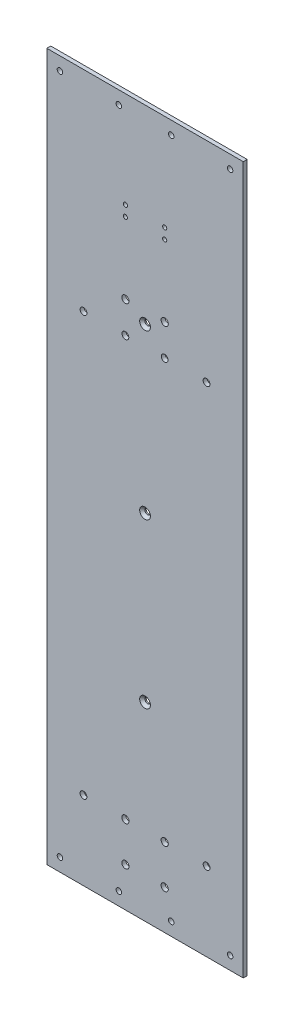
from build123d import *

# Parameters (mm, degrees)
SKETCH_1_W          = 150
SKETCH_1_H          = 540
EXTRUDE_1_DEPTH     = 3
SKETCH_2_R          = 2.1
SKETCH_2_R_2        = 1.6
CUT_EXTRUDE_1_DEPTH = 281.239183556
CUT_EXTRUDE_2_REACH = 282.239
SKETCH_4_R          = 2.1
CHAMFER_1_SIZE      = 2
CUT_EXTRUDE_4_REACH = 282.239
SKETCH_6_R          = 2.6
SKETCH_6_R_2        = 2.599999997
CUT_EXTRUDE_5_REACH = 282.239
SKETCH_7_R          = 2.75
CUT_EXTRUDE_6_REACH = 282.239
SKETCH_8_R          = 2.75
SKETCH_9_R          = 2.75
CUT_EXTRUDE_7_DEPTH = 10


with BuildPart() as part:
    # 草图1 → 凸台-拉伸1 (new body)
    with BuildSketch(Plane.XY):
        Rectangle(SKETCH_1_W, SKETCH_1_H)
    extrude(amount=EXTRUDE_1_DEPTH)

    # 草图2 → 切除-拉伸1 (cut, through all)
    with BuildSketch(Plane(origin=(0, 0, 0), x_dir=(-1, 0, 0), z_dir=(0, 0, -1))):
        with Locations((65, -260)):
            Circle(SKETCH_2_R)
        with Locations((-65, -260)):
            Circle(SKETCH_2_R)
        with Locations((65, 260)):
            Circle(SKETCH_2_R)
        with Locations((-65, 260)):
            Circle(SKETCH_2_R)
        with Locations((-20, -260)):
            Circle(SKETCH_2_R)
        with Locations((20, -260)):
            Circle(SKETCH_2_R)
        with Locations((20, 260)):
            Circle(SKETCH_2_R)
        with Locations((-20, 260)):
            Circle(SKETCH_2_R)
        with Locations((15, 196.5)):
            Circle(SKETCH_2_R_2)
        with Locations((15, 188.5)):
            Circle(SKETCH_2_R_2)
        with Locations((-15, 196.5)):
            Circle(SKETCH_2_R_2)
        with Locations((-15, 188.5)):
            Circle(SKETCH_2_R_2)
    extrude(amount=-CUT_EXTRUDE_1_DEPTH, mode=Mode.SUBTRACT)

    # 草图4 → 切除-拉伸2 (cut, up to next)
    with BuildSketch(Plane.XY.offset(3), mode=Mode.PRIVATE) as cut_extrude_2_sk1:
        with Locations((0, 125)):
            Circle(SKETCH_4_R)
    cut_extrude_2_tool1 = extrude(cut_extrude_2_sk1.sketch, amount=-CUT_EXTRUDE_2_REACH, mode=Mode.PRIVATE) & part.part
    # 草图4 → 切除-拉伸2 (cut, up to next)
    with BuildSketch(Plane.XY.offset(3), mode=Mode.PRIVATE) as cut_extrude_2_sk2:
        with Locations((0, -125)):
            Circle(SKETCH_4_R)
    cut_extrude_2_tool2 = extrude(cut_extrude_2_sk2.sketch, amount=-CUT_EXTRUDE_2_REACH, mode=Mode.PRIVATE) & part.part
    # 草图4 → 切除-拉伸2 (cut, up to next)
    with BuildSketch(Plane.XY.offset(3), mode=Mode.PRIVATE) as cut_extrude_2_sk3:
        Circle(SKETCH_4_R)
    cut_extrude_2_tool3 = extrude(cut_extrude_2_sk3.sketch, amount=-CUT_EXTRUDE_2_REACH, mode=Mode.PRIVATE) & part.part
    add(cut_extrude_2_tool1.solids().sort_by_distance((0, 125, 3))[0], mode=Mode.SUBTRACT)
    add(cut_extrude_2_tool2.solids().sort_by_distance((0, -125, 3))[0], mode=Mode.SUBTRACT)
    add(cut_extrude_2_tool3.solids().sort_by_distance((0, 0, 3))[0], mode=Mode.SUBTRACT)

    # 倒角1
    chamfer_1_edges = [part.edges().sort_by_distance(p)[0] for p in [
        (-2.1, 0, 3),
        (-2.1, -125, 3),
        (-2.1, 125, 3),
    ]]
    chamfer(chamfer_1_edges, length=CHAMFER_1_SIZE)

    # 草图6 → 切除-拉伸4 (cut, up to next)
    with BuildSketch(Plane.XY.offset(3), mode=Mode.PRIVATE) as cut_extrude_4_sk1:
        with Locations((15, -210)):
            Circle(SKETCH_6_R)
    cut_extrude_4_tool1 = extrude(cut_extrude_4_sk1.sketch, amount=-CUT_EXTRUDE_4_REACH, mode=Mode.PRIVATE) & part.part
    # 草图6 → 切除-拉伸4 (cut, up to next)
    with BuildSketch(Plane.XY.offset(3), mode=Mode.PRIVATE) as cut_extrude_4_sk2:
        with Locations((-15, -210)):
            Circle(SKETCH_6_R)
    cut_extrude_4_tool2 = extrude(cut_extrude_4_sk2.sketch, amount=-CUT_EXTRUDE_4_REACH, mode=Mode.PRIVATE) & part.part
    # 草图6 → 切除-拉伸4 (cut, up to next)
    with BuildSketch(Plane.XY.offset(3), mode=Mode.PRIVATE) as cut_extrude_4_sk3:
        with Locations((47, -210)):
            Circle(SKETCH_6_R)
    cut_extrude_4_tool3 = extrude(cut_extrude_4_sk3.sketch, amount=-CUT_EXTRUDE_4_REACH, mode=Mode.PRIVATE) & part.part
    # 草图6 → 切除-拉伸4 (cut, up to next)
    with BuildSketch(Plane.XY.offset(3), mode=Mode.PRIVATE) as cut_extrude_4_sk4:
        with Locations((-47, -210)):
            Circle(SKETCH_6_R)
    cut_extrude_4_tool4 = extrude(cut_extrude_4_sk4.sketch, amount=-CUT_EXTRUDE_4_REACH, mode=Mode.PRIVATE) & part.part
    # 草图6 → 切除-拉伸4 (cut, up to next)
    with BuildSketch(Plane.XY.offset(3), mode=Mode.PRIVATE) as cut_extrude_4_sk5:
        with Locations((-47, 110)):
            Circle(SKETCH_6_R)
    cut_extrude_4_tool5 = extrude(cut_extrude_4_sk5.sketch, amount=-CUT_EXTRUDE_4_REACH, mode=Mode.PRIVATE) & part.part
    # 草图6 → 切除-拉伸4 (cut, up to next)
    with BuildSketch(Plane.XY.offset(3), mode=Mode.PRIVATE) as cut_extrude_4_sk6:
        with Locations((-14.999999999, 110.000445606)):
            Circle(SKETCH_6_R)
    cut_extrude_4_tool6 = extrude(cut_extrude_4_sk6.sketch, amount=-CUT_EXTRUDE_4_REACH, mode=Mode.PRIVATE) & part.part
    # 草图6 → 切除-拉伸4 (cut, up to next)
    with BuildSketch(Plane.XY.offset(3), mode=Mode.PRIVATE) as cut_extrude_4_sk7:
        with Locations((15.000000002, 110.000863362)):
            Circle(SKETCH_6_R_2)
    cut_extrude_4_tool7 = extrude(cut_extrude_4_sk7.sketch, amount=-CUT_EXTRUDE_4_REACH, mode=Mode.PRIVATE) & part.part
    # 草图6 → 切除-拉伸4 (cut, up to next)
    with BuildSketch(Plane.XY.offset(3), mode=Mode.PRIVATE) as cut_extrude_4_sk8:
        with Locations((47, 110.001253333)):
            Circle(SKETCH_6_R)
    cut_extrude_4_tool8 = extrude(cut_extrude_4_sk8.sketch, amount=-CUT_EXTRUDE_4_REACH, mode=Mode.PRIVATE) & part.part
    add(cut_extrude_4_tool1.solids().sort_by_distance((15, -210, 3))[0], mode=Mode.SUBTRACT)
    add(cut_extrude_4_tool2.solids().sort_by_distance((-15, -210, 3))[0], mode=Mode.SUBTRACT)
    add(cut_extrude_4_tool3.solids().sort_by_distance((47, -210, 3))[0], mode=Mode.SUBTRACT)
    add(cut_extrude_4_tool4.solids().sort_by_distance((-47, -210, 3))[0], mode=Mode.SUBTRACT)
    add(cut_extrude_4_tool5.solids().sort_by_distance((-47, 110, 3))[0], mode=Mode.SUBTRACT)
    add(cut_extrude_4_tool6.solids().sort_by_distance((-15, 110.000446, 3))[0], mode=Mode.SUBTRACT)
    add(cut_extrude_4_tool7.solids().sort_by_distance((15, 110.000863, 3))[0], mode=Mode.SUBTRACT)
    add(cut_extrude_4_tool8.solids().sort_by_distance((47, 110.001253, 3))[0], mode=Mode.SUBTRACT)

    # 草图7 → 切除-拉伸5 (cut, up to next)
    with BuildSketch(Plane.XY.offset(3), mode=Mode.PRIVATE) as cut_extrude_5_sk1:
        with Locations((-15, 134)):
            Circle(SKETCH_7_R)
    cut_extrude_5_tool1 = extrude(cut_extrude_5_sk1.sketch, amount=-CUT_EXTRUDE_5_REACH, mode=Mode.PRIVATE) & part.part
    # 草图7 → 切除-拉伸5 (cut, up to next)
    with BuildSketch(Plane.XY.offset(3), mode=Mode.PRIVATE) as cut_extrude_5_sk2:
        with Locations((15, 134)):
            Circle(SKETCH_7_R)
    cut_extrude_5_tool2 = extrude(cut_extrude_5_sk2.sketch, amount=-CUT_EXTRUDE_5_REACH, mode=Mode.PRIVATE) & part.part
    add(cut_extrude_5_tool1.solids().sort_by_distance((-15, 134, 3))[0], mode=Mode.SUBTRACT)
    add(cut_extrude_5_tool2.solids().sort_by_distance((15, 134, 3))[0], mode=Mode.SUBTRACT)

    # 草图8 → 切除-拉伸6 (cut, up to next)
    with BuildSketch(Plane.XY.offset(3), mode=Mode.PRIVATE) as cut_extrude_6_sk1:
        with Locations((-15, -210)):
            Circle(SKETCH_8_R)
    cut_extrude_6_tool1 = extrude(cut_extrude_6_sk1.sketch, amount=-CUT_EXTRUDE_6_REACH, mode=Mode.PRIVATE) & part.part
    # 草图8 → 切除-拉伸6 (cut, up to next)
    with BuildSketch(Plane.XY.offset(3), mode=Mode.PRIVATE) as cut_extrude_6_sk2:
        with Locations((15, -210)):
            Circle(SKETCH_8_R)
    cut_extrude_6_tool2 = extrude(cut_extrude_6_sk2.sketch, amount=-CUT_EXTRUDE_6_REACH, mode=Mode.PRIVATE) & part.part
    add(cut_extrude_6_tool1.solids().sort_by_distance((-15, -210, 3))[0], mode=Mode.SUBTRACT)
    add(cut_extrude_6_tool2.solids().sort_by_distance((15, -210, 3))[0], mode=Mode.SUBTRACT)

    # 草图9 → 切除-拉伸7 (cut)
    with BuildSketch(Plane.XY.offset(3)):
        with Locations((-15, -240)):
            Circle(SKETCH_9_R)
        with Locations((15, -240)):
            Circle(SKETCH_9_R)
    extrude(amount=-CUT_EXTRUDE_7_DEPTH, mode=Mode.SUBTRACT)


solid = part.part
